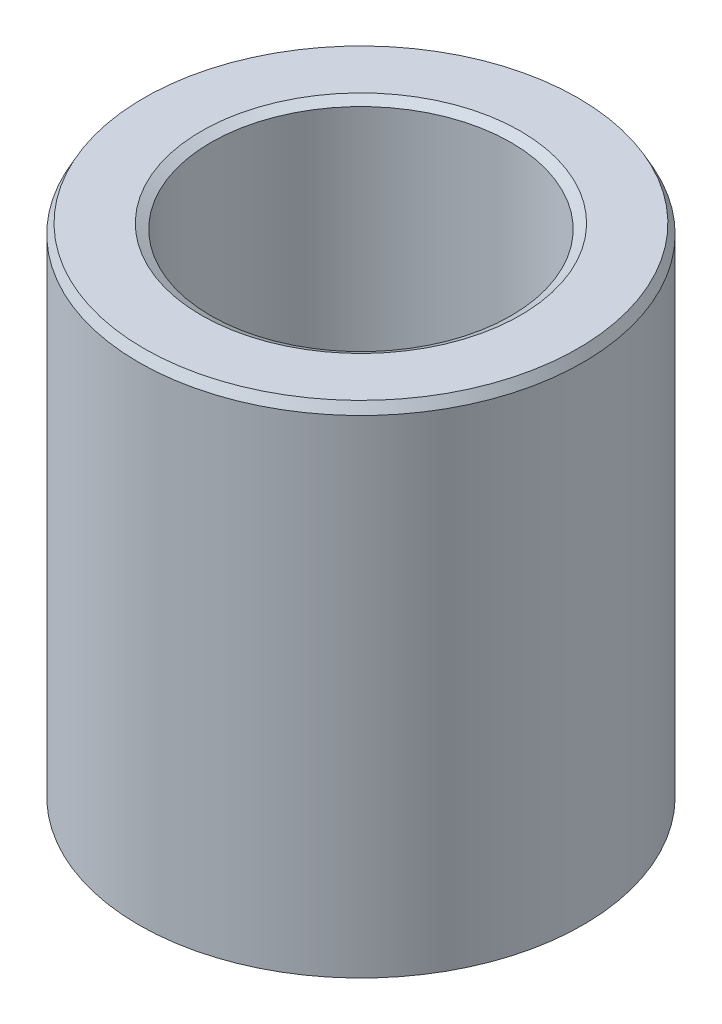
from build123d import *
from OCP.BRepFilletAPI import BRepFilletAPI_MakeChamfer

# Parameters (mm, degrees)
SKETCH1_R           = 57.5
BOSS_EXTRUDE1_DEPTH = 129.85400634
SKETCH2_R           = 38.841887945
CUT_EXTRUDE1_DEPTH  = 154.214108236
CHAMFER1_SIZE       = 2.451709092
CHAMFER1_SIZE2      = 1.327552546


with BuildPart() as part:
    # Sketch1 → Boss-Extrude1 (new body)
    with BuildSketch(Plane(origin=(0, 0, 0), x_dir=(1, 0, 0), z_dir=(0, 1, 0))):
        Circle(SKETCH1_R)
    extrude(amount=BOSS_EXTRUDE1_DEPTH)

    # Sketch2 → Cut-Extrude1 (cut, through all)
    with BuildSketch(Plane(origin=(0, 0, 0), x_dir=(1, 0, 0), z_dir=(0, 1, 0))):
        Circle(SKETCH2_R)
    extrude(amount=CUT_EXTRUDE1_DEPTH, mode=Mode.SUBTRACT)

    # Chamfer1: one chamfer whose edges measure the first distance from different faces: ONE call of the kernel's chamfer builder (chamfer() names one face for all edges)
    chamfer1_edges_1 = [part.edges().sort_by_distance(p)[0] for p in [
        (-38.841887945, 129.85400634, 0),
    ]]
    chamfer1_side_1 = [part.faces().sort_by_distance(p)[0] for p in [
        (-55.873654403, 129.85400634, 0),
    ]]
    chamfer1_edges_2 = [part.edges().sort_by_distance(p)[0] for p in [
        (-38.841887945, 0, 0),
    ]]
    chamfer1_side_2 = [part.faces().sort_by_distance(p)[0] for p in [
        (-38.841887945, 64.92700317, 0),
    ]]
    chamfer1_edges_3 = [part.edges().sort_by_distance(p)[0] for p in [
        (-57.5, 0, 0),
    ]]
    chamfer1_side_3 = [part.faces().sort_by_distance(p)[0] for p in [
        (-55.873654403, 0, 0),
    ]]
    chamfer1_edges_4 = [part.edges().sort_by_distance(p)[0] for p in [
        (-57.5, 129.85400634, 0),
    ]]
    chamfer1_side_4 = [part.faces().sort_by_distance(p)[0] for p in [
        (-57.5, 64.92700317, 0),
    ]]
    chamfer1 = BRepFilletAPI_MakeChamfer(part.part.solid().wrapped)
    for e in chamfer1_edges_1:
        chamfer1.Add(CHAMFER1_SIZE, CHAMFER1_SIZE2, e.wrapped, chamfer1_side_1[0].wrapped)  # the first distance lies on this face
    for e in chamfer1_edges_2:
        chamfer1.Add(CHAMFER1_SIZE, CHAMFER1_SIZE2, e.wrapped, chamfer1_side_2[0].wrapped)  # the first distance lies on this face
    for e in chamfer1_edges_3:
        chamfer1.Add(CHAMFER1_SIZE, CHAMFER1_SIZE2, e.wrapped, chamfer1_side_3[0].wrapped)  # the first distance lies on this face
    for e in chamfer1_edges_4:
        chamfer1.Add(CHAMFER1_SIZE, CHAMFER1_SIZE2, e.wrapped, chamfer1_side_4[0].wrapped)  # the first distance lies on this face
    add(Compound.cast(chamfer1.Shape()), mode=Mode.REPLACE)


solid = part.part
